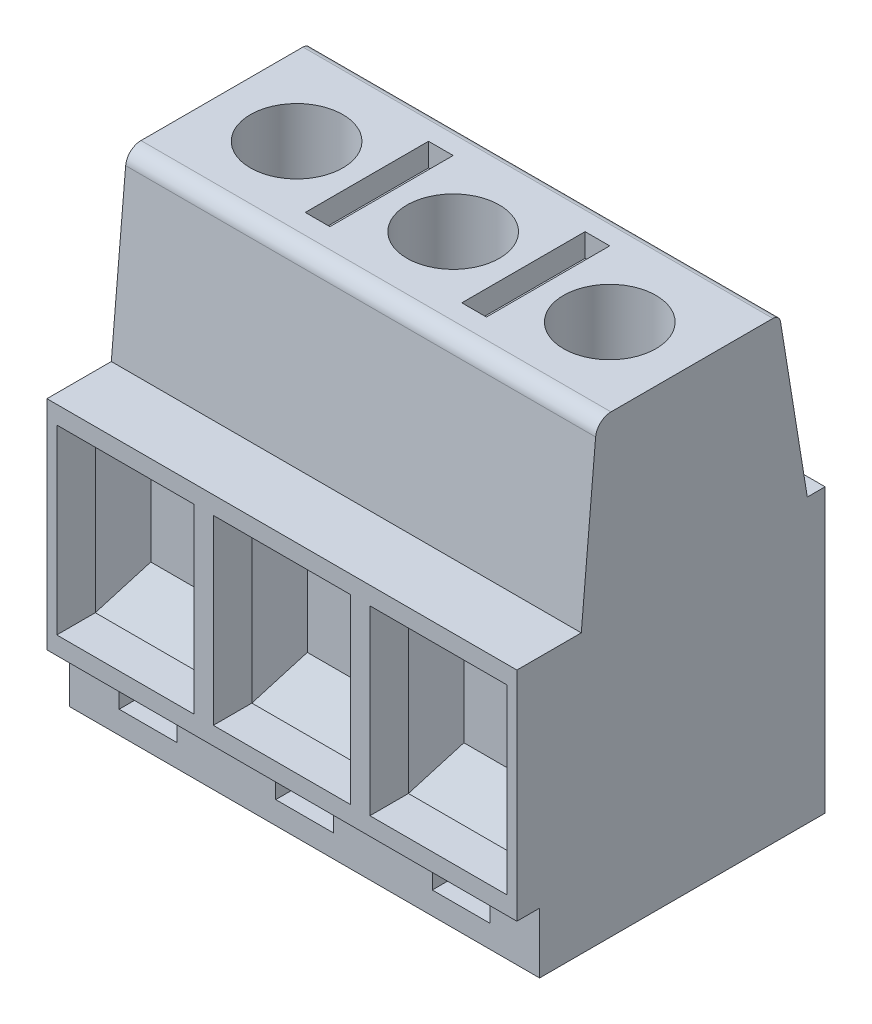
from build123d import *

# Parameters (mm, degrees)
BOSS_EXTRUDE1_DEPTH    = 10.16
SKETCH2_W              = 8.900000000000002
SKETCH2_H              = 11.800000000000011
CUT_EXTRUDE1_DEPTH     = 2.5
SKETCH5_R              = 2.9999999999999996
CUT_EXTRUDE2_DEPTH     = 5.7
SKETCH7_W              = 1.2999999999999998
SKETCH7_H              = 0.8000000000000007
SKETCH7_H_2            = 0.7999999999999936
BOSS_EXTRUDE2_DEPTH    = 4.5
CUT_EXTRUDE5_START     = -10.96
CUT_EXTRUDE5_DEPTH     = 10.96
SKETCH10_R             = 1.4999999999999998
CUT_EXTRUDE6_DEPTH     = 4.5
SKETCH13_W             = 3.75
SKETCH13_H             = 1
CUT_EXTRUDE8_DEPTH     = 3
FILLET3_R              = 0.5
FILLET4_R              = 1
SKETCH12_W             = 1.2999999999999998
SKETCH12_H             = 1.299999999999999
BOSS_EXTRUDE3_DEPTH    = 0.5
BOSS_EXTRUDE3_2_DEPTH  = 0.5
BOSS_EXTRUDE3_3_DEPTH  = 0.5
BOSS_EXTRUDE4_START    = 0.01
BOSS_EXTRUDE4_DEPTH    = 0.01
LPATTERN8_COUNT        = 3
LPATTERN8_PITCH        = 10.16
LPATTERN8_2_COUNT      = 3
LPATTERN8_2_PITCH      = 10.16
LPATTERN8_3_COUNT      = 3
LPATTERN8_3_PITCH      = 10.16
LPATTERN8_4_COUNT      = 3
LPATTERN8_4_PITCH      = 10.16
FILLET3_OF_LPATTERN8_R = 0.5
FILLET4_OF_LPATTERN8_R = 1
SKETCH11_W             = 1.6
SKETCH11_H             = 8
CUT_EXTRUDE7_DEPTH     = 1.5
LPATTERN9_COUNT        = 2
LPATTERN9_PITCH        = 10.16
BOSS_EXTRUDE6_DEPTH    = 0.01


# Read off the part's stored shape, not the designer's step: Cut-Extrude5
with BuildPart() as part:
    # Sketch1 → Boss-Extrude1 (new body)
    with BuildSketch(Plane(origin=(0, 0, 0), x_dir=(0, 0, -1), z_dir=(1, 0, 0))):
        Polygon((9.669213470381848, 32.96915259715871), (9.669213470381848, 47.08678337249189), (13.847501539912686, 47.08678337249189), (14.859335014289963, 58.54185616450892), (26.70903057031256, 58.54185616450892), (28.514863984729242, 47.38649061080074), (29.669213470381848, 47.38649061080074), (29.66921347038185, 29.041856164508925), (11.142277404209432, 29.04185616450892), (11.142277404209432, 32.96915259715871), align=None)
    boss_extrude1 = extrude(amount=BOSS_EXTRUDE1_DEPTH)

    # Sketch2 → Cut-Extrude1 (cut)
    with BuildSketch(Plane.XY.offset(-9.669213470381848)):
        with Locations((5.08, 40.0279679848253)):
            Rectangle(SKETCH2_W, SKETCH2_H)
    cut_extrude1 = extrude(amount=-CUT_EXTRUDE1_DEPTH, mode=Mode.SUBTRACT)

    # Sketch3 → Cut-Loft1 section 0
    with BuildSketch(Plane.XY.offset(-12.169213470381848)):
        with BuildLine():
            Line((9.530000000000001, 34.1279679848253), (9.530000000000001, 45.92796798482531))
            Line((9.530000000000001, 45.92796798482531), (0.6299999999999994, 45.92796798482531))
            Line((0.6299999999999994, 45.92796798482531), (0.6299999999999994, 34.1279679848253))
            Line((0.6299999999999994, 34.1279679848253), (9.530000000000001, 34.1279679848253))
        make_face()
    # Sketch4 → Cut-Loft1 section 1
    with BuildSketch(Plane.XY.offset(-14.069213470381849)):
        with BuildLine():
            Line((2.3299999999999987, 36.877967984825304), (7.829999999999998, 36.877967984825304))
            Line((7.829999999999998, 36.877967984825304), (7.829999999999998, 43.1779679848253))
            Line((7.829999999999998, 43.1779679848253), (2.3299999999999987, 43.1779679848253))
            Line((2.3299999999999987, 43.1779679848253), (2.3299999999999987, 36.877967984825304))
        make_face()
    cut_loft1 = loft(mode=Mode.SUBTRACT)

    # Sketch5 → Cut-Extrude2 (cut)
    with BuildSketch(Plane(origin=(0, 58.54185616450892, 0), x_dir=(1, 0, 0), z_dir=(0, 1, 0))):
        with Locations(Location((5.08, 20.784182792301262, 0), (0, 0, 270))):
            Circle(SKETCH5_R)
    cut_extrude2 = extrude(amount=-CUT_EXTRUDE2_DEPTH, mode=Mode.SUBTRACT)

    # Sketch7 → Boss-Extrude2 (add)
    with BuildSketch(Plane.XZ.offset(-29.041856164508918)):
        with Locations((5.08, -27.169213470381862)):
            Rectangle(SKETCH7_W, SKETCH7_H)
        with Locations((5.08, -17.00921347038186)):
            Rectangle(SKETCH7_W, SKETCH7_H_2)
    boss_extrude2 = extrude(amount=BOSS_EXTRUDE2_DEPTH)

    # Cut-Extrude5 outline → Cut-Extrude5 (cut)
    with BuildSketch(Plane.XY.offset(-16.60921347038186).offset(CUT_EXTRUDE5_START)):
        with BuildLine():
            Line((5.73, 24.541856165), (5.73, 25.191856165))
            ThreePointArc((5.73, 25.191856165), (5.539619408, 24.732236757), (5.08, 24.541856165))
            Line((5.08, 24.541856165), (5.73, 24.541856165))
        make_face()
        with BuildLine():
            Line((4.43, 24.541856165), (5.08, 24.541856165))
            ThreePointArc((5.08, 24.541856165), (4.620380592, 24.732236757), (4.43, 25.191856165))
            Line((4.43, 25.191856165), (4.43, 24.541856165))
        make_face()
    cut_extrude5 = extrude(amount=CUT_EXTRUDE5_DEPTH, mode=Mode.SUBTRACT)

    # Sketch10 → Cut-Extrude6 (cut)
    with BuildSketch(Plane(origin=(0, 38.527852040591384, -38.527852040591256), x_dir=(-1, 0, 0), z_dir=(0, 0.7071067811865488, -0.7071067811865464))):
        with Locations(Location((-5.08, 12.528006810151506, 0), (0, 0, 90))):
            Circle(SKETCH10_R)
    cut_extrude6 = extrude(amount=-CUT_EXTRUDE6_DEPTH, mode=Mode.SUBTRACT)

    # Sketch13 → Cut-Extrude8 (cut)
    with BuildSketch(Plane.XY.offset(-11.142277404209432)):
        with Locations((5.080000000000007, 31.005504380833823)):
            Rectangle(SKETCH13_W, SKETCH13_H)
    cut_extrude8 = extrude(amount=-CUT_EXTRUDE8_DEPTH, mode=Mode.SUBTRACT)

    # Fillet3
    fillet3_edges = [part.edges().sort_by_distance(p)[0] for p in [
        (5.08, 58.54185616450892, -26.70903057031256),
    ]]
    fillet(fillet3_edges, radius=FILLET3_R)

    # Fillet4
    fillet4_edges = [part.edges().sort_by_distance(p)[0] for p in [
        (5.08, 58.54185616450892, -14.859335014289963),
    ]]
    fillet(fillet4_edges, radius=FILLET4_R)

    # Sketch14 → Boss-Extrude4 (add)
    with BuildSketch(Plane(origin=(10.16, 0, 0), x_dir=(0, 0, -1), z_dir=(1, 0, 0)).offset(BOSS_EXTRUDE4_START)):
        with BuildLine():
            Line((14.77877644669124, 57.629844179105966), (13.847501539912686, 47.08678337249189))
            Line((13.847501539912686, 47.08678337249189), (9.669213470381848, 47.08678337249189))
            Line((9.669213470381848, 47.08678337249189), (9.669213470381848, 32.96915259715871))
            Line((9.669213470381848, 32.96915259715871), (11.142277404209432, 32.96915259715871))
            Line((11.142277404209432, 32.96915259715871), (11.142277404209432, 29.04185616450892))
            Line((11.142277404209432, 29.04185616450892), (29.66921347038185, 29.041856164508925))
            Line((29.66921347038185, 29.041856164508925), (29.669213470381848, 47.38649061080074))
            Line((29.669213470381848, 47.38649061080074), (28.514863984729242, 47.38649061080074))
            Line((28.514863984729242, 47.38649061080074), (26.777036465378647, 58.121756163471794))
            ThreePointArc((26.777036465378647, 58.121756163471794), (26.607537368480997, 58.42261199143836), (26.28346175961899, 58.54185616450892))
            Line((26.28346175961899, 58.54185616450892), (15.77489798008326, 58.54185616450892))
            ThreePointArc((15.77489798008326, 58.54185616450892), (15.09961582223998, 58.279415658582806), (14.77877644669124, 57.629844179105966))
        make_face()
    extrude(amount=-BOSS_EXTRUDE4_DEPTH)



with BuildPart() as body_2:
    # Sketch12 → Boss-Extrude3 (new body)
    with BuildSketch(Plane.XZ.offset(-29.041856164508918)):
        with Locations((3.9e-16, -15.192277404209438)):
            Rectangle(SKETCH12_W, SKETCH12_H)
    boss_extrude3 = extrude(amount=BOSS_EXTRUDE3_DEPTH)


with BuildPart() as body_3:
    # Sketch12 → Boss-Extrude3 2 (new body)
    with BuildSketch(Plane.XZ.offset(-29.041856164508918)):
        Polygon((-0.6500000000000012, -20.342277404209444), (0.6499999999999989, -20.342277404209444), (0.649999999999998, -19.04227740420944), (-0.6500000000000012, -19.04227740420944), align=None)
    boss_extrude3_2 = extrude(amount=BOSS_EXTRUDE3_2_DEPTH)


with BuildPart() as body_4:
    # Sketch12 → Boss-Extrude3 3 (new body)
    with BuildSketch(Plane.XZ.offset(-29.041856164508918)):
        Polygon((-0.6499999999999996, -25.042277404209447), (0.6500000000000006, -25.042277404209447), (0.6500000000000008, -23.742277404209442), (-0.6499999999999996, -23.742277404209442), align=None)
    boss_extrude3_3 = extrude(amount=BOSS_EXTRUDE3_3_DEPTH)


with BuildPart() as part_1:
    add(part.part)

    add(body_2.part)  # LPattern8 merges body 2

    add(body_3.part)  # LPattern8 merges body 3

    add(body_4.part)  # LPattern8 merges body 4
    # LPattern8: Boss-Extrude1 ×3
    with Locations(*[(-i * LPATTERN8_PITCH, 0, 0) for i in range(1, LPATTERN8_COUNT)]):
        add(boss_extrude1)

    # LPattern8 2: Cut-Extrude1, Cut-Loft1, Cut-Extrude2 ×3
    with Locations(*[(-i * LPATTERN8_2_PITCH, 0, 0) for i in range(1, LPATTERN8_2_COUNT)]):
        add(cut_extrude1, mode=Mode.SUBTRACT)
        add(cut_loft1, mode=Mode.SUBTRACT)
        add(cut_extrude2, mode=Mode.SUBTRACT)

    # LPattern8 3: Boss-Extrude2 ×3
    with Locations(*[(-i * LPATTERN8_3_PITCH, 0, 0) for i in range(1, LPATTERN8_3_COUNT)]):
        add(boss_extrude2)

    # LPattern8 4: Cut-Extrude5, Cut-Extrude6, Cut-Extrude8 ×3
    with Locations(*[(-i * LPATTERN8_4_PITCH, 0, 0) for i in range(1, LPATTERN8_4_COUNT)]):
        add(cut_extrude5, mode=Mode.SUBTRACT)
        add(cut_extrude6, mode=Mode.SUBTRACT)
        add(cut_extrude8, mode=Mode.SUBTRACT)

    # Fillet3 of LPattern8
    fillet3_of_lpattern8_edges = [part_1.edges().sort_by_distance(p)[0] for p in [
        (-5.08, 58.54185616450892, -26.70903057031256),
        (-15.24, 58.54185616450892, -26.70903057031256),
    ]]
    fillet(fillet3_of_lpattern8_edges, radius=FILLET3_OF_LPATTERN8_R)

    # Fillet4 of LPattern8
    fillet4_of_lpattern8_edges = [part_1.edges().sort_by_distance(p)[0] for p in [
        (-5.08, 58.54185616450892, -14.859335014289963),
        (-15.24, 58.54185616450892, -14.859335014289963),
    ]]
    fillet(fillet4_of_lpattern8_edges, radius=FILLET4_OF_LPATTERN8_R)

    # Sketch11 → Cut-Extrude7 (cut)
    with BuildSketch(Plane(origin=(0, 58.54185616450892, 0), x_dir=(1, 0, 0), z_dir=(0, 1, 0))):
        with Locations((4.16e-15, 21.064117563348077)):
            Rectangle(SKETCH11_W, SKETCH11_H)
    cut_extrude7 = extrude(amount=-CUT_EXTRUDE7_DEPTH, mode=Mode.SUBTRACT)

    # LPattern9: Boss-Extrude3, Boss-Extrude3 2, Boss-Extrude3 3, Cut-Extrude7 ×2
    with Locations(*[(-i * LPATTERN9_PITCH, 0, 0) for i in range(1, LPATTERN9_COUNT)]):
        add(boss_extrude3)
        add(boss_extrude3_2)
        add(boss_extrude3_3)
        add(cut_extrude7, mode=Mode.SUBTRACT)

    # Sketch16 → Boss-Extrude6 (add)
    with BuildSketch(Plane.ZY.offset(20.32)):
        with BuildLine():
            Line((-13.847501539912686, 47.08678337249189), (-14.77877644669124, 57.629844179105966))
            ThreePointArc((-14.77877644669124, 57.629844179105966), (-15.09961582223998, 58.279415658582806), (-15.77489798008326, 58.54185616450892))
            Line((-15.77489798008326, 58.54185616450892), (-26.28346175961899, 58.54185616450892))
            ThreePointArc((-26.28346175961899, 58.54185616450892), (-26.607537368480997, 58.42261199143836), (-26.777036465378647, 58.121756163471794))
            Line((-26.777036465378647, 58.121756163471794), (-28.514863984729242, 47.38649061080074))
            Line((-28.514863984729242, 47.38649061080074), (-29.669213470381848, 47.38649061080074))
            Line((-29.669213470381848, 47.38649061080074), (-29.66921347038185, 29.041856164508925))
            Line((-29.66921347038185, 29.041856164508925), (-11.142277404209432, 29.04185616450892))
            Line((-11.142277404209432, 29.04185616450892), (-11.142277404209432, 32.96915259715871))
            Line((-11.142277404209432, 32.96915259715871), (-9.669213470381848, 32.96915259715871))
            Line((-9.669213470381848, 32.96915259715871), (-9.669213470381848, 47.08678337249189))
            Line((-9.669213470381848, 47.08678337249189), (-13.847501539912686, 47.08678337249189))
        make_face()
    extrude(amount=BOSS_EXTRUDE6_DEPTH)


solid = part_1.part
